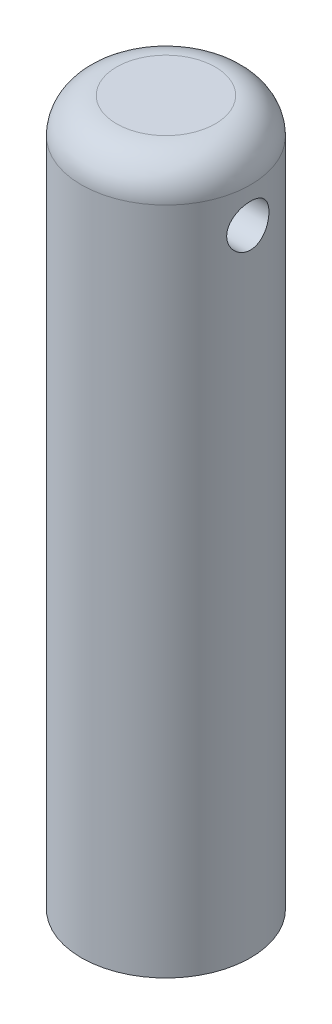
from build123d import *

# Parameters (mm, degrees)
SKETCH_1_R          = 12
SKETCH_1_R_2        = 6
EXTRUDE_1_DEPTH     = 80
CUT_EXTRUDE_1_DEPTH = 17
FILLET_1_R          = 1
SKETCH_3_R          = 12
EXTRUDE_2_DEPTH     = 20
FILLET_2_R          = 5
SKETCH_4_R          = 3
CUT_EXTRUDE_3_DEPTH = 22.5


with BuildPart() as part:
    # Эскиз1 → Вытянуть1 (new body)
    with BuildSketch(Plane(origin=(0, 0, 0), x_dir=(1, 0, 0), z_dir=(0, 1, 0))):
        Circle(SKETCH_1_R)
        Circle(SKETCH_1_R_2, mode=Mode.SUBTRACT)
    extrude(amount=EXTRUDE_1_DEPTH)

    # Эскиз2 → Вырез-Вытянуть1 (cut)
    with BuildSketch(Plane.XZ):
        Polygon((6.883625854, -3.933459236), (6.84828855, 3.994665242), (-0.035337304, 7.928124478), (-6.883625854, 3.933459236), (-6.84828855, -3.994665242), (0.035337304, -7.928124478), align=None)
    extrude(amount=-CUT_EXTRUDE_1_DEPTH, mode=Mode.SUBTRACT)

    # Скругление1
    fillet_1_edges = [part.edges().sort_by_distance(p)[0] for p in [
        (-6.84828855, 8.5, -3.994665242),
        (0.035337304, 8.5, -7.928124478),
        (6.883625854, 8.5, -3.933459236),
        (6.84828855, 8.5, 3.994665242),
        (-0.035337304, 8.5, 7.928124478),
        (-6.883625854, 8.5, 3.933459236),
    ]]
    fillet(fillet_1_edges, radius=FILLET_1_R)

    # Эскиз3 → Вытянуть2 (add)
    with BuildSketch(Plane(origin=(0, 80, 0), x_dir=(1, 0, 0), z_dir=(0, 1, 0))):
        Circle(SKETCH_3_R)
    extrude(amount=EXTRUDE_2_DEPTH)

    # Скругление2
    fillet_2_edges = [part.edges().sort_by_distance(p)[0] for p in [
        (-12, 100, 0),
    ]]
    fillet(fillet_2_edges, radius=FILLET_2_R)

    # Эскиз4 → Вытянуть3 (cut, symmetric)
    with BuildSketch(Plane(origin=(0, 0, 0), x_dir=(0, 0, -1), z_dir=(1, 0, 0))):
        with Locations((0, 90)):
            Circle(SKETCH_4_R)
    extrude(amount=CUT_EXTRUDE_3_DEPTH, both=True, mode=Mode.SUBTRACT)


solid = part.part
